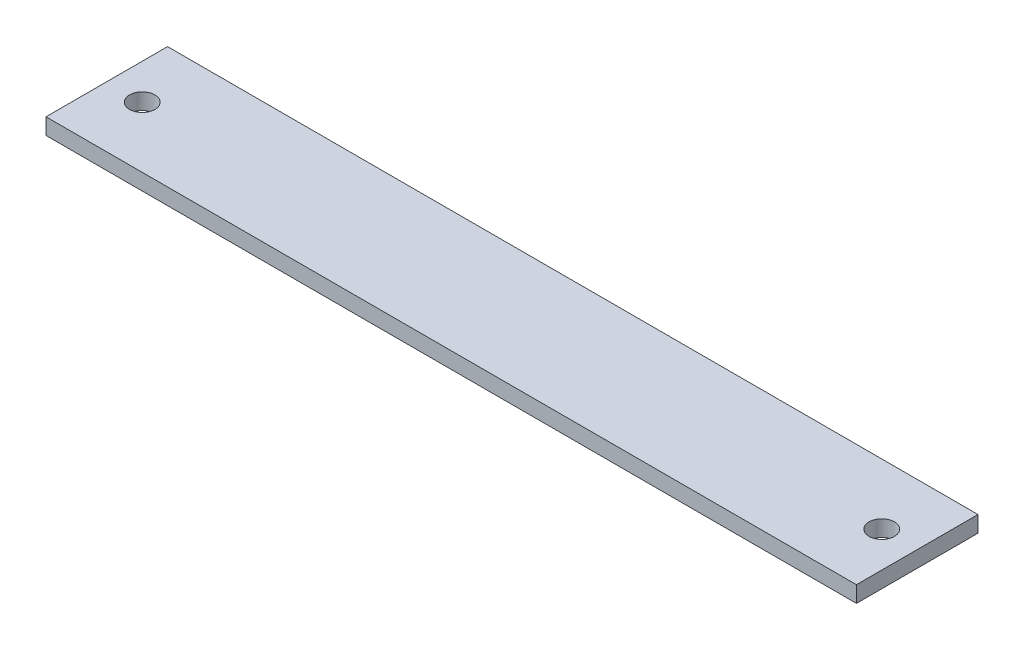
from build123d import *

# Parameters (mm, degrees)
SKETCH1_W         = 80
SKETCH1_H         = 12
PCB_DEPTH         = 1.6
SKETCH2_R         = 1.25
SCREW_HOLES_DEPTH = 81.910815099


with BuildPart() as part:
    # Sketch1 → pcb (new body)
    with BuildSketch(Plane(origin=(0, 0, 0), x_dir=(1, 0, 0), z_dir=(0, 1, 0))):
        with Locations((-40, 6)):
            Rectangle(SKETCH1_W, SKETCH1_H)
    extrude(amount=PCB_DEPTH)

    # Sketch2 → screw holes (cut, through all)
    with BuildSketch(Plane(origin=(0, 1.6, 0), x_dir=(1, 0, 0), z_dir=(0, 1, 0))):
        with Locations((-76.5, 6)):
            Circle(SKETCH2_R)
        with Locations((-3.5, 6)):
            Circle(SKETCH2_R)
    extrude(amount=-SCREW_HOLES_DEPTH, mode=Mode.SUBTRACT)


solid = part.part
